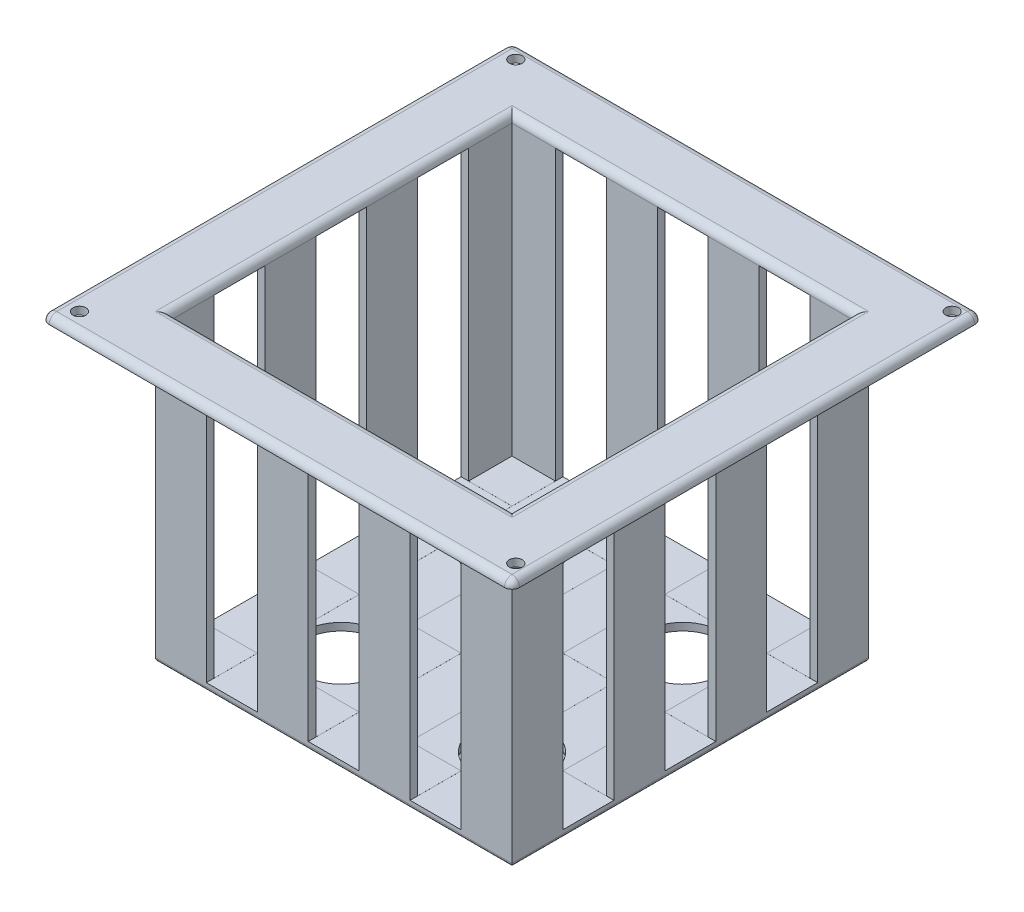
from build123d import *

# Parameters (mm, degrees)
SKETCH_1_W               = 94
SKETCH_1_H               = 94
EXTRUDE_1_DEPTH          = 80
SKETCH_1_3_W             = 90
SKETCH_1_3_H             = 90
CUT_EXTRUDE_1_DEPTH      = 78
SKETCH_1_5_W             = 124
SKETCH_1_5_H             = 124
SKETCH_1_5_W_2           = 94
SKETCH_1_5_H_2           = 94
EXTRUDE_2_DEPTH          = 2
FILLET_1_R               = 2
CUT_EXTRUDE_4_DEPTH      = 162.89480683
CUT_EXTRUDE_5_DEPTH      = 162.89480683
CUT_EXTRUDE_6_DEPTH      = 162.89480683
SKETCH_6_W               = 13.428571429
SKETCH_6_H               = 76.0093606
CUT_EXTRUDE_7_DEPTH      = 150.641361191
SKETCH_6_3_W             = 13.428571429
SKETCH_6_3_H             = 76.0093606
CUT_EXTRUDE_8_DEPTH      = 150.641361191
CUT_EXTRUDE_9_DEPTH      = 150.641361191
CUT_EXTRUDE_9_DEPTH_BACK = 150.641361191
SKETCH_6_4_W             = 13.428571428
SKETCH_6_4_H             = 76.0093606
SKETCH_8_R               = 2.5
CUT_EXTRUDE_13_DEPTH     = 135.627134923
SKETCH_8_4_R             = 8
CUT_EXTRUDE_16_DEPTH     = 1
SKETCH_8_5_R             = 10
CUT_EXTRUDE_17_DEPTH     = 135.627134923
FILLET_2_R               = 2
FILLET_4_R               = 2
FILLET_10_R              = 1
SKETCH_10_R              = 1.7
CUT_EXTRUDE_18_DEPTH     = 10


with BuildPart() as part:
    # 草图1 → 凸台-拉伸1 (new body)
    with BuildSketch(Plane(origin=(0, 0, 0), x_dir=(1, 0, 0), z_dir=(0, 1, 0))):
        with Locations((2.121267759, 27.044530874)):
            Rectangle(SKETCH_1_W, SKETCH_1_H)
    extrude(amount=-EXTRUDE_1_DEPTH)

    # 草图1<3> → 切除-拉伸1 (cut)
    with BuildSketch(Plane(origin=(0, 0, 0), x_dir=(1, 0, 0), z_dir=(0, 1, 0))):
        with Locations((2.121267759, 27.044530874)):
            Rectangle(SKETCH_1_3_W, SKETCH_1_3_H)
    extrude(amount=-CUT_EXTRUDE_1_DEPTH, mode=Mode.SUBTRACT)

    # 草图1<5> → 凸台-拉伸2 (add)
    with BuildSketch(Plane(origin=(0, 0, 0), x_dir=(1, 0, 0), z_dir=(0, 1, 0))):
        with Locations((2.121267759, 27.044530874)):
            Rectangle(SKETCH_1_5_W, SKETCH_1_5_H)
        with Locations((2.121267759, 27.044530874)):
            Rectangle(SKETCH_1_5_W_2, SKETCH_1_5_H_2, mode=Mode.SUBTRACT)
    extrude(amount=-EXTRUDE_2_DEPTH)

    # 圆角1
    fillet_1_edges = [part.edges().sort_by_distance(p)[0] for p in [
        (2.121267759, 0, -72.044530874),
        (47.121267759, 0, -27.044530874),
        (-42.878732241, 0, -27.044530874),
        (2.121267759, 0, 17.955469126),
    ]]
    fillet(fillet_1_edges, radius=FILLET_1_R)

    # 草图5 → 切除-拉伸4 (cut, through all)
    with BuildSketch(Plane(origin=(49.121267759, 0, 0), x_dir=(0, 0, -1), z_dir=(1, 0, 0))):
        Polygon((-6.526897697, -78.001337229), (-6.526897697, -2), (6.901673731, -2), (6.901673731, -78.002674457), align=None)
    extrude(amount=-CUT_EXTRUDE_4_DEPTH, mode=Mode.SUBTRACT)

    # 草图5<5> → 切除-拉伸5 (cut, through all)
    with BuildSketch(Plane(origin=(49.121267759, 0, 0), x_dir=(0, 0, -1), z_dir=(1, 0, 0))):
        Polygon((20.33024516, -78.004011686), (20.33024516, -2), (33.758816589, -2), (33.758816589, -78.005348914), align=None)
    extrude(amount=-CUT_EXTRUDE_5_DEPTH, mode=Mode.SUBTRACT)

    # 草图5<6> → 切除-拉伸6 (cut, through all)
    with BuildSketch(Plane(origin=(49.121267759, 0, 0), x_dir=(0, 0, -1), z_dir=(1, 0, 0))):
        Polygon((47.187388017, -78.006686143), (47.187388017, -2), (60.615959446, -2), (60.615959446, -78.008023372), align=None)
    extrude(amount=-CUT_EXTRUDE_6_DEPTH, mode=Mode.SUBTRACT)

    # 草图6 → 切除-拉伸7 (cut, through all)
    with BuildSketch(Plane(origin=(0, 0, -74.044530874), x_dir=(-1, 0, 0), z_dir=(0, 0, -1))):
        with Locations((-28.978410616, -40.0046803)):
            Rectangle(SKETCH_6_W, SKETCH_6_H)
    extrude(amount=-CUT_EXTRUDE_7_DEPTH, mode=Mode.SUBTRACT)

    # 草图6<3> → 切除-拉伸8 (cut, through all)
    with BuildSketch(Plane(origin=(0, 0, -74.044530874), x_dir=(-1, 0, 0), z_dir=(0, 0, -1))):
        with Locations((-2.12126776, -40.0046803)):
            Rectangle(SKETCH_6_3_W, SKETCH_6_3_H)
    extrude(amount=-CUT_EXTRUDE_8_DEPTH, mode=Mode.SUBTRACT)

    # 草图6<4> → 切除-拉伸9 (cut, two sides: drawn at the far end of the back side and taken through both)
    with BuildSketch(Plane(origin=(0, 0, -74.044530874), x_dir=(-1, 0, 0), z_dir=(0, 0, -1)).offset(-CUT_EXTRUDE_9_DEPTH_BACK)):
        with Locations((24.735875098, -40.0046803)):
            Rectangle(SKETCH_6_4_W, SKETCH_6_4_H)
    extrude(amount=CUT_EXTRUDE_9_DEPTH + CUT_EXTRUDE_9_DEPTH_BACK, mode=Mode.SUBTRACT)

    # 草图8 → 切除-拉伸13 (cut, through all)
    with BuildSketch(Plane(origin=(0, -78, 0), x_dir=(-1, 0, 0), z_dir=(0, -1, 0))):
        with Locations(Location((-2.148108933, 27.017689701, 0), (0, 0, 270))):
            Circle(SKETCH_8_R)
    extrude(amount=CUT_EXTRUDE_13_DEPTH, mode=Mode.SUBTRACT)

    # 草图8<4> → 切除-拉伸16 (cut)
    with BuildSketch(Plane(origin=(0, -78, 0), x_dir=(-1, 0, 0), z_dir=(0, -1, 0))):
        with Locations(Location((-2.148108933, 27.017689701, 0), (0, 0, 213.287140052))):
            Circle(SKETCH_8_4_R)
    extrude(amount=CUT_EXTRUDE_16_DEPTH, mode=Mode.SUBTRACT)

    # 草图8<5> → 切除-拉伸17 (cut, through all)
    with BuildSketch(Plane(origin=(0, -78, 0), x_dir=(-1, 0, 0), z_dir=(0, -1, 0))):
        with Locations(Location((20.365311654, 4.531110288, 0), (0, 0, 256.445379393))):
            Circle(SKETCH_8_5_R)
        with Locations(Location((-24.634688346, 49.531110288, 0), (0, 0, 283.712868299))):
            Circle(SKETCH_8_5_R)
        with Locations(Location((-24.634688346, 4.531110288, 0), (0, 0, 283.712868299))):
            Circle(SKETCH_8_5_R)
        with Locations(Location((20.365311654, 49.531110288, 0), (0, 0, 256.445379393))):
            Circle(SKETCH_8_5_R)
    extrude(amount=CUT_EXTRUDE_17_DEPTH, mode=Mode.SUBTRACT)

    # 圆角2
    fillet_2_edges = [part.edges().sort_by_distance(p)[0] for p in [
        (-59.878732241, -1, 34.955469126),
        (-59.878732241, -1, -89.044530874),
        (64.121267759, -1, -89.044530874),
        (64.121267759, -1, 34.955469126),
    ]]
    fillet(fillet_2_edges, radius=FILLET_2_R)

    # 圆角4
    fillet_4_edges = [part.edges().sort_by_distance(p)[0] for p in [
        (2.121267759, 0, 34.955469126),
        (-59.878732241, 0, -27.044530874),
        (64.121267759, 0, -27.044530874),
        (2.121267759, 0, -89.044530874),
        (-59.292945803, 0, -88.458744437),
        (63.535481322, 0, -88.458744437),
        (-59.292945803, 0, 34.369682688),
        (63.535481322, 0, 34.369682688),
    ]]
    fillet(fillet_4_edges, radius=FILLET_4_R - 0.0001)  # a hair under: the kernel refuses the full size

    # 圆角10
    fillet_10_edges = [part.edges().sort_by_distance(p)[0] for p in [
        (2.121267759, -80, 19.955469126),
        (-44.878732241, -80, -27.044530874),
        (2.121267759, -80, -74.044530874),
        (49.121267759, -80, -27.044530874),
    ]]
    fillet(fillet_10_edges, radius=FILLET_10_R)

    # 草图10 → 切除-拉伸18 (cut)
    with BuildSketch(Plane.XZ.offset(7)):
        with Locations(Location((60.121267759, 29.955469126, 0), (0, 0, 270))):
            Circle(SKETCH_10_R)
        with Locations(Location((60.121267759, -85.044530874, 0), (0, 0, 270))):
            Circle(SKETCH_10_R)
        with Locations(Location((-54.878732241, -85.044530874, 0), (0, 0, 270))):
            Circle(SKETCH_10_R)
        with Locations(Location((-54.878732241, 29.955469126, 0), (0, 0, 270))):
            Circle(SKETCH_10_R)
    extrude(amount=-CUT_EXTRUDE_18_DEPTH, mode=Mode.SUBTRACT)


solid = part.part
